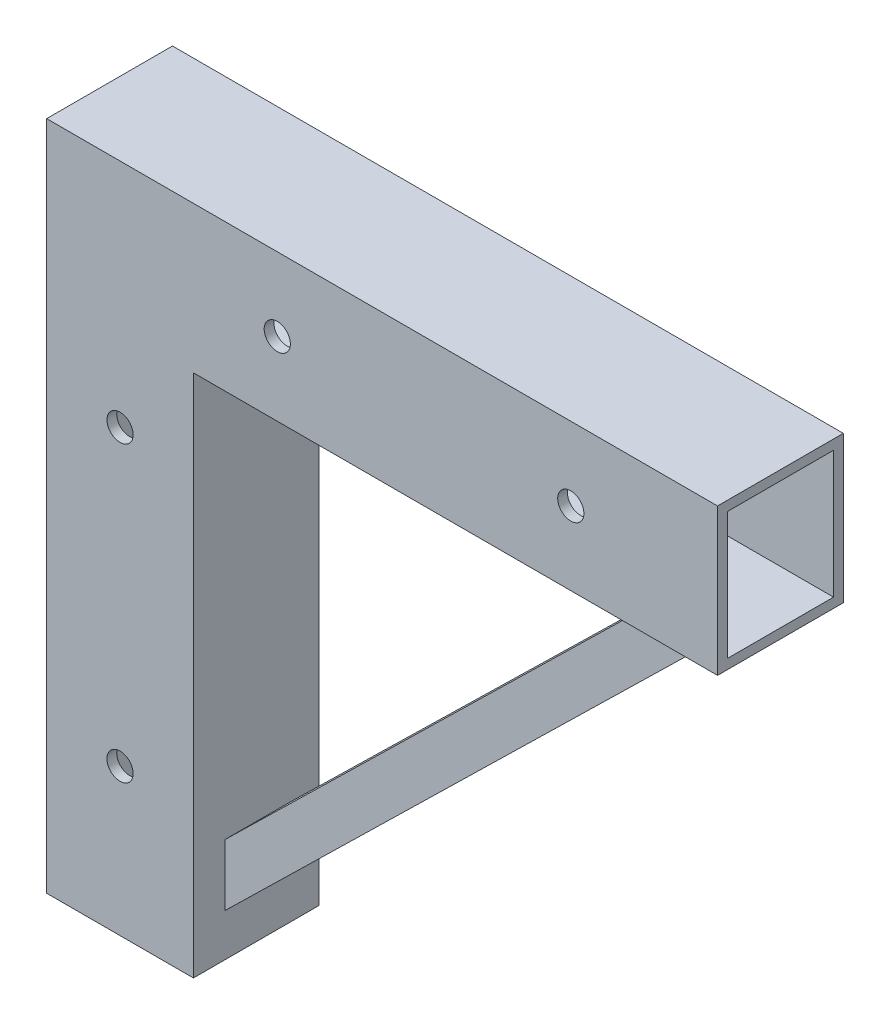
from build123d import *

# Parameters (mm, degrees)
BOSS_EXTRUDE1_DEPTH = 76.2
SKETCH2_W           = 64.3636
SKETCH2_H           = 77.0636
CUT_EXTRUDE1_DEPTH  = 400.05
SKETCH3_W           = 77.0636
SKETCH3_H           = 64.3636
CUT_EXTRUDE2_DEPTH  = 400.05
SWEEP2_START        = 19.05
SWEEP2_DEPTH        = 38.1
SKETCH12_R          = 7.9375
CUT_EXTRUDE3_DEPTH  = 400.05


# Read off the part's stored shape, not the designer's step: Sweep2
with BuildPart() as part:
    # Sketch1 → Boss-Extrude1 (new body)
    with BuildSketch(Plane.XY):
        Polygon((0, 0), (0, -317.5), (-88.9, -317.5), (-88.9, 88.9), (317.5, 88.9), (317.5, 0), align=None)
    extrude(amount=BOSS_EXTRUDE1_DEPTH)

    # Sketch2 → Cut-Extrude1 (cut)
    with BuildSketch(Plane(origin=(317.5, 0, 0), x_dir=(0, 0, -1), z_dir=(1, 0, 0))):
        with Locations((-38.1, 44.45)):
            Rectangle(SKETCH2_W, SKETCH2_H)
    extrude(amount=-CUT_EXTRUDE1_DEPTH, mode=Mode.SUBTRACT)

    # Sketch3 → Cut-Extrude2 (cut)
    with BuildSketch(Plane.XZ.offset(317.5)):
        with Locations((-44.45, 38.1)):
            Rectangle(SKETCH3_W, SKETCH3_H)
    extrude(amount=-CUT_EXTRUDE2_DEPTH, mode=Mode.SUBTRACT)

    # Sweep2 outline → Sweep2 (add)
    with BuildSketch(Plane.XY.offset(SWEEP2_START)):
        Polygon((0, -254.432954545), (0, -291.667045455), (298.45, 0), (260.35, 0), align=None)
    extrude(amount=SWEEP2_DEPTH)

    # Sketch12 → Cut-Extrude3 (cut)
    with BuildSketch(Plane(origin=(0, 0, 0), x_dir=(-1, 0, 0), z_dir=(0, 0, -1))):
        with Locations((44.45, -228.6)):
            Circle(SKETCH12_R)
        with Locations((44.45, -50.8)):
            Circle(SKETCH12_R)
        with Locations((-50.8, 44.45)):
            Circle(SKETCH12_R)
        with Locations((-228.6, 44.45)):
            Circle(SKETCH12_R)
    extrude(amount=-CUT_EXTRUDE3_DEPTH, mode=Mode.SUBTRACT)


solid = part.part
